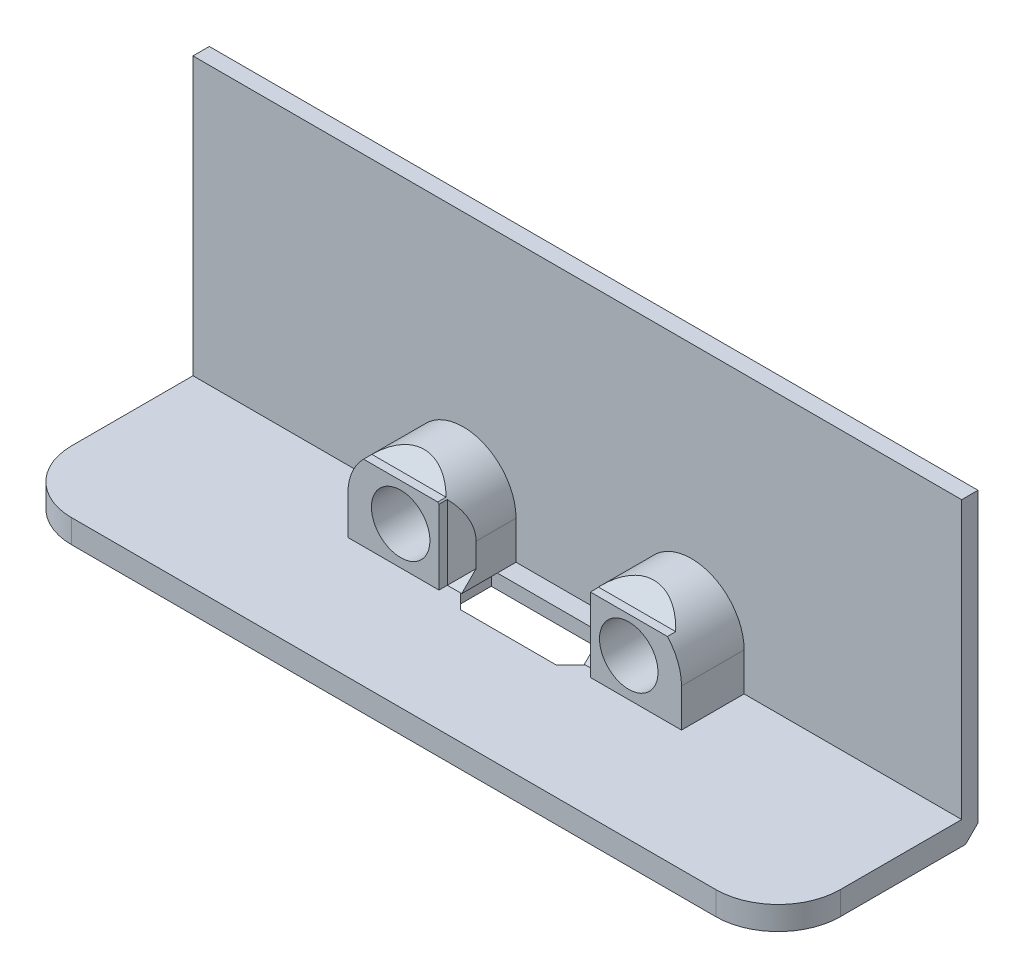
from build123d import *

# Parameters (mm, degrees)
BOSS_EXTRUDE1_DEPTH                           = 1
BOSS_EXTRUDE2_DEPTH                           = 1.44
CUT_EXTRUDE1_DEPTH                            = 32.926898982
SKETCH4_W                                     = 11.303
SKETCH4_H                                     = 6.1214
CUT_EXTRUDE2_DEPTH                            = 0.551
CUT_EXTRUDE2_DRAFT                            = -45
SKETCH5_R                                     = 1.7907
BOSS_EXTRUDE3_DEPTH                           = 3.8354
CSK_FOR_4_FLAT_HEAD_MACHINE_SCREW1_AT_2_COUNT = 2
CSK_FOR_4_FLAT_HEAD_MACHINE_SCREW1_AT_2_PITCH = 13.97
CUT_EXTRUDE3_START                            = -0.508
CUT_EXTRUDE3_DEPTH                            = 31.455448587
CUT_EXTRUDE3_OTHER_WAY_DEPTH                  = 2.6924
CUT_EXTRUDE3_OTHER_WAY_TAPER                  = 45
CHAMFER1_SIZE                                 = 0.762


with BuildPart() as part:
    # Sketch1 → Boss-Extrude1 (new body)
    with BuildSketch(Plane.XY):
        Polygon((-23.54, 16.9654), (-6.35, 16.9654), (6.35, 16.9654), (23.54, 16.9654), (23.54, 0), (-23.54, 0), align=None)
    extrude(amount=-BOSS_EXTRUDE1_DEPTH)

    # Sketch2 → Boss-Extrude2 (add)
    with BuildSketch(Plane.XZ):
        with BuildLine():
            Line((-23.54, 0), (-23.54, -1))
            Line((-23.54, -1), (23.54, -1))
            Line((23.54, -1), (23.54, 0))
            Line((23.54, 0), (23.54, 7.434399914))
            ThreePointArc((23.54, 7.434399914), (22.424076836, 10.12847675), (19.73, 11.244399914))
            Line((19.73, 11.244399914), (-19.73, 11.244399914))
            ThreePointArc((-19.73, 11.244399914), (-22.424076836, 10.12847675), (-23.54, 7.434399914))
            Line((-23.54, 7.434399914), (-23.54, 0))
        make_face()
    extrude(amount=BOSS_EXTRUDE2_DEPTH)

    # Sketch3 → Cut-Extrude1 (cut, through all)
    with BuildSketch(Plane.XZ.offset(1.44)):
        Polygon((4.1275, 1.143), (4.1275, 3.035802139), (2.946902139, 4.2164), (-2.946902139, 4.2164), (-4.1275, 3.035802139), (-4.1275, 1.143), align=None)
    extrude(amount=-CUT_EXTRUDE1_DEPTH, mode=Mode.SUBTRACT)


with BuildPart() as cut_extrude2_tool:
    # Sketch4 → Cut-Extrude2 (with draft: the straight prism first)
    with BuildSketch(Plane.XZ.offset(1.44)):
        with Locations((0, 2.6797)):
            Rectangle(SKETCH4_W, SKETCH4_H)
    extrude(amount=-CUT_EXTRUDE2_DEPTH)
    # Cut-Extrude2: the draft: its side faces are tilted about the plane it starts from
    cut_extrude2_sides = [cut_extrude2_tool.faces().sort_by_distance(p)[0] for p in [
        (5.6515, -1.1645, 2.6797),
        (0, -1.1645, 5.7404),
        (-5.6515, -1.1645, 2.6797),
        (0, -1.1645, -0.381),
    ]]
    draft(cut_extrude2_sides, Plane.XZ.offset(1.44), CUT_EXTRUDE2_DRAFT)


with BuildPart() as part_1:
    add(part.part)

    # Cut-Extrude2: cut by cut_extrude2_tool
    add(cut_extrude2_tool.part, mode=Mode.SUBTRACT)

    # Sketch5 → Boss-Extrude3 (add)
    # profile 1 of 2: a face of its own
    with BuildSketch(Plane.XY):
        with BuildLine():
            Line((10.2157, 0), (10.2157, 2.3368))
            ThreePointArc((10.2157, 2.3368), (6.985, 5.5675), (3.7543, 2.3368))
            Line((3.7543, 2.3368), (3.7543, 0))
            Line((3.7543, 0), (10.2157, 0))
        make_face()
        with Locations(Location((6.985, 2.3368, 0), (0, 0, 90))):
            Circle(SKETCH5_R, mode=Mode.SUBTRACT)
    # profile 2 of 2: a face of its own
    with BuildSketch(Plane.XY):
        with BuildLine():
            Line((-3.7543, 0), (-3.7543, 2.3368))
            ThreePointArc((-3.7543, 2.3368), (-6.985, 5.5675), (-10.2157, 2.3368))
            Line((-10.2157, 2.3368), (-10.2157, 0))
            Line((-10.2157, 0), (-3.7543, 0))
        make_face()
        with Locations(Location((-6.985, 2.3368, 0), (0, 0, 90))):
            Circle(SKETCH5_R, mode=Mode.SUBTRACT)
    extrude(amount=BOSS_EXTRUDE3_DEPTH)

    # Sketch7 → CSK for #4 Flat Head Machine Screw1 (revolve, cut)
    with BuildSketch(Plane(origin=(6.985, 2.3368, -1), x_dir=(0, 1, 0), z_dir=(1, 0, 0))):
        Polygon((0, 0), (0, 12.244399914), (1.63195, 12.244399914), (1.63195, 1.663834001), (2.8575, 0.254), (2.8575, 0), align=None)
    csk_for_4_flat_head_machine_screw1 = revolve(axis=Axis((6.985, 2.3368, -7.35), (0, 0, 1)), mode=Mode.SUBTRACT)

    # CSK for #4 Flat Head Machine Screw1 at 2: CSK for #4 Flat Head Machine Screw1 ×2
    with Locations(*[(-i * CSK_FOR_4_FLAT_HEAD_MACHINE_SCREW1_AT_2_PITCH, 0, 0) for i in range(1, CSK_FOR_4_FLAT_HEAD_MACHINE_SCREW1_AT_2_COUNT)]):
        add(csk_for_4_flat_head_machine_screw1, mode=Mode.SUBTRACT)

    # Sketch8 → Cut-Extrude3 (cut)
    with BuildSketch(Plane.XY.offset(3.8354).offset(CUT_EXTRUDE3_START)):
        Polygon((-4.6355, 0), (4.6355, 0), (4.6355, 4.535000865), (11.25247277, 4.535000865), (11.25247277, 13.015959744), (-11.892824973, 13.015959744), (-11.892824973, 4.635051274), (-4.6355, 4.635051274), align=None)
    extrude(amount=CUT_EXTRUDE3_DEPTH, mode=Mode.SUBTRACT)

    # Sketch8 → Cut-Extrude3 other way (cut)
    with BuildSketch(Plane.XY.offset(3.8354).offset(CUT_EXTRUDE3_START)):
        Polygon((-4.6355, 0), (4.6355, 0), (4.6355, 4.535000865), (11.25247277, 4.535000865), (11.25247277, 13.015959744), (-11.892824973, 13.015959744), (-11.892824973, 4.635051274), (-4.6355, 4.635051274), align=None)
    extrude(amount=-CUT_EXTRUDE3_OTHER_WAY_DEPTH, taper=CUT_EXTRUDE3_OTHER_WAY_TAPER, mode=Mode.SUBTRACT)

    # Chamfer1
    # the kernel refuses this chamfer: 0.762 mm, written as the material it takes off along each edge
    with BuildSketch(Plane(origin=(-25.499622437, -1.44, -1), x_dir=(0, 0.9996219169112966, -0.027495876610586417), z_dir=(1, 0, 0))) as chamfer1_piece_1:
        Polygon((CHAMFER1_SIZE * 0.999621916911, CHAMFER1_SIZE * 0.0274958766106), (-CHAMFER1_SIZE * 0.0274958766106, CHAMFER1_SIZE * 0.999621916911), (0, 0), align=None)
    extrude(amount=50.999244874, mode=Mode.SUBTRACT)


solid = part_1.part
